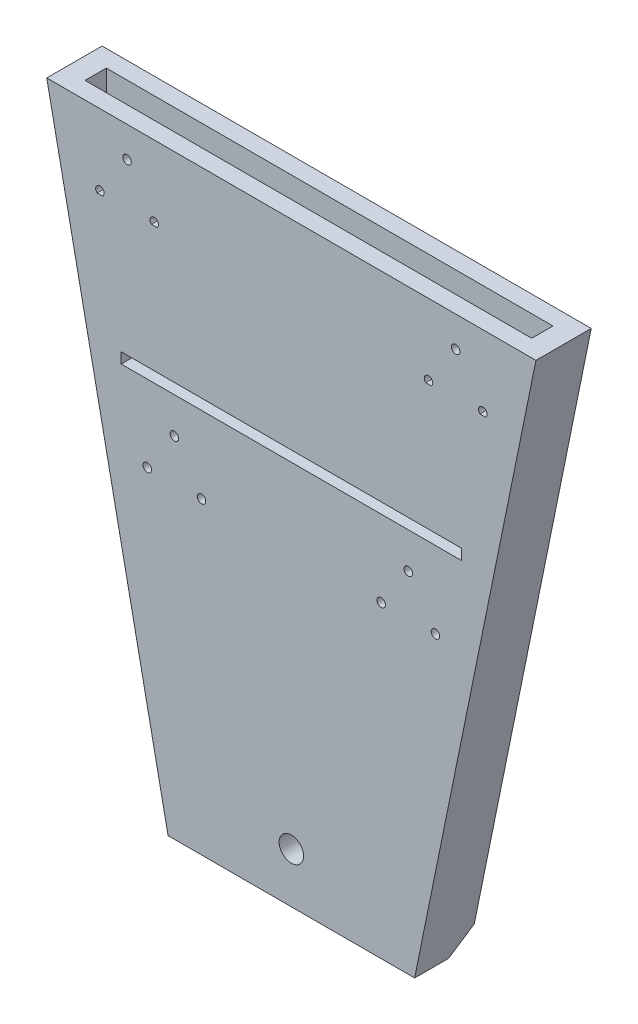
from build123d import *

# Parameters (mm, degrees)
EXTRUDE_1_DEPTH     = 8
CUT_EXTRUDE_1_DEPTH = 8.6
EXTRUDE_2_DEPTH     = 8
EXTRUDE_3_DEPTH     = 10
SKETCH_7_R          = 5.75
CUT_EXTRUDE_2_DEPTH = 22
EXTRUDE_5_DEPTH     = 26
CUT_EXTRUDE_4_DEPTH = 21
CHAMFER_6_SIZE      = 5
CHAMFER_8_SIZE      = 10
SKETCH_13_W         = 210
SKETCH_13_H         = 10
CUT_EXTRUDE_5_DEPTH = 15
SKETCH_14_W         = 160
SKETCH_14_H         = 5
CUT_EXTRUDE_6_DEPTH = 10
SKETCH_16_R         = 2
CUT_EXTRUDE_7_DEPTH = 10
SKETCH_18_W         = 109.386418102
SKETCH_18_H         = 16
EXTRUDE_7_DEPTH     = 2
CHAMFER_10_SIZE     = 2


with BuildPart() as part:
    # 草图1 → 凸台-拉伸1 (new body)
    with BuildSketch(Plane.XY):
        Polygon((-60, 0), (60, 0), (115, 270), (-115, 270), align=None)
    extrude(amount=EXTRUDE_1_DEPTH)

    # 草图2 → 切除-拉伸1 (cut)
    with BuildSketch(Plane.XY.offset(8)):
        with BuildLine():
            Line((0.005000474, 0.310000947), (0, 0.3))
            Line((0, 0.3), (17.48870838, 0.3))
            Line((17.48870838, 0.3), (12.108893566, 26.71))
            Line((12.108893566, 26.71), (0, 26.71))
            ThreePointArc((0, 26.71), (-13.199999763, 13.507499763), (0.005000474, 0.310000947))
        make_face()
    extrude(amount=-CUT_EXTRUDE_1_DEPTH, mode=Mode.SUBTRACT)

    # 草图5 → 凸台-拉伸2 (add)
    with BuildSketch(Plane(origin=(0, 0, 0), x_dir=(-1, 0, 0), z_dir=(0, 0, -1))):
        Polygon((60, 0), (115, 270), (-115, 270), (-60, 0), align=None)
    extrude(amount=EXTRUDE_2_DEPTH)

    # 草图6 → 凸台-拉伸3 (add)
    with BuildSketch(Plane.XY.offset(8)):
        Polygon((-115, 270), (-60, 0), (60, 0), (115, 270), align=None)
    extrude(amount=EXTRUDE_3_DEPTH)

    # 草图7 → 切除-拉伸2 (cut)
    with BuildSketch(Plane.XY.offset(18)):
        with Locations((0, 13.51)):
            Circle(SKETCH_7_R)
    extrude(amount=-CUT_EXTRUDE_2_DEPTH, mode=Mode.SUBTRACT)

    # 草图9 → 凸台-拉伸5 (add)
    with BuildSketch(Plane.XY.offset(18)):
        Polygon((-57.962962963, -10), (-60, 0), (60, 0), (57.962962963, -10), align=None)
    extrude(amount=-EXTRUDE_5_DEPTH)

    # 草图12 → 切除-拉伸4 (cut)
    with BuildSketch(Plane.XY.offset(-8)):
        Polygon((54.693209051, 0), (-54.693209051, 0), (-52.656172014, -10), (52.656172014, -10), align=None)
    extrude(amount=CUT_EXTRUDE_4_DEPTH, mode=Mode.SUBTRACT)

    # 倒角6
    chamfer_6_edges = [part.edges().sort_by_distance(p)[0] for p in [
        (0, 0, -8),
    ]]
    chamfer(chamfer_6_edges, length=CHAMFER_6_SIZE)

    # 倒角8
    chamfer_8_edges = [part.edges().sort_by_distance(p)[0] for p in [
        (55.309567488, -10, -8),
        (-55.309567488, -10, -8),
    ]]
    chamfer(chamfer_8_edges, length=CHAMFER_8_SIZE)

    # 草图13 → 切除-拉伸5 (cut)
    with BuildSketch(Plane(origin=(0, 270, 0), x_dir=(1, 0, 0), z_dir=(0, 1, 0))):
        with Locations((0, -5)):
            Rectangle(SKETCH_13_W, SKETCH_13_H)
    extrude(amount=-CUT_EXTRUDE_5_DEPTH, mode=Mode.SUBTRACT)

    # 草图14 → 切除-拉伸6 (cut)
    with BuildSketch(Plane.XY.offset(18)):
        with Locations((0, 173.51)):
            Rectangle(SKETCH_14_W, SKETCH_14_H)
    extrude(amount=-CUT_EXTRUDE_6_DEPTH, mode=Mode.SUBTRACT)

    # 草图16 → 切除-拉伸7 (cut)
    with BuildSketch(Plane.XY.offset(18)):
        with BuildLine():
            ThreePointArc((-88.677124344, 235), (-90, 238.5), (-91.322875656, 235))
            Line((-91.322875656, 235), (-88.677124344, 235))
        make_face()
        with BuildLine():
            ThreePointArc((91.322875656, 235), (90, 238.5), (88.677124344, 235))
            Line((88.677124344, 235), (91.322875656, 235))
        make_face()
        with BuildLine():
            ThreePointArc((65.822875656, 235), (64.5, 238.5), (63.177124344, 235))
            Line((63.177124344, 235), (65.822875656, 235))
        make_face()
        with BuildLine():
            ThreePointArc((-63.177124344, 235), (-64.5, 238.5), (-65.822875656, 235))
            Line((-65.822875656, 235), (-63.177124344, 235))
        make_face()
        with Locations((-77.25, 255.6425573)):
            Circle(SKETCH_16_R)
        with Locations((77.25, 255.6425573)):
            Circle(SKETCH_16_R)
        with Locations((-55, 154.1525573)):
            Circle(SKETCH_16_R)
        with Locations((-67.75, 135.01)):
            Circle(SKETCH_16_R)
        with Locations((-42.25, 135.01)):
            Circle(SKETCH_16_R)
        with Locations((42.25, 135.01)):
            Circle(SKETCH_16_R)
        with Locations((67.75, 135.01)):
            Circle(SKETCH_16_R)
        with Locations((55, 154.1525573)):
            Circle(SKETCH_16_R)
    extrude(amount=-CUT_EXTRUDE_7_DEPTH, mode=Mode.SUBTRACT)

    # 草图18 → 凸台-拉伸7 (add)
    with BuildSketch(Plane.XZ):
        with Locations((0, 5)):
            Rectangle(SKETCH_18_W, SKETCH_18_H)
    extrude(amount=EXTRUDE_7_DEPTH)

    # 倒角10
    chamfer_10_edges = [part.edges().sort_by_distance(p)[0] for p in [
        (0, -2, -3),
    ]]
    chamfer(chamfer_10_edges, length=CHAMFER_10_SIZE - 0.0001)  # a hair under: the kernel refuses the full size


solid = part.part
